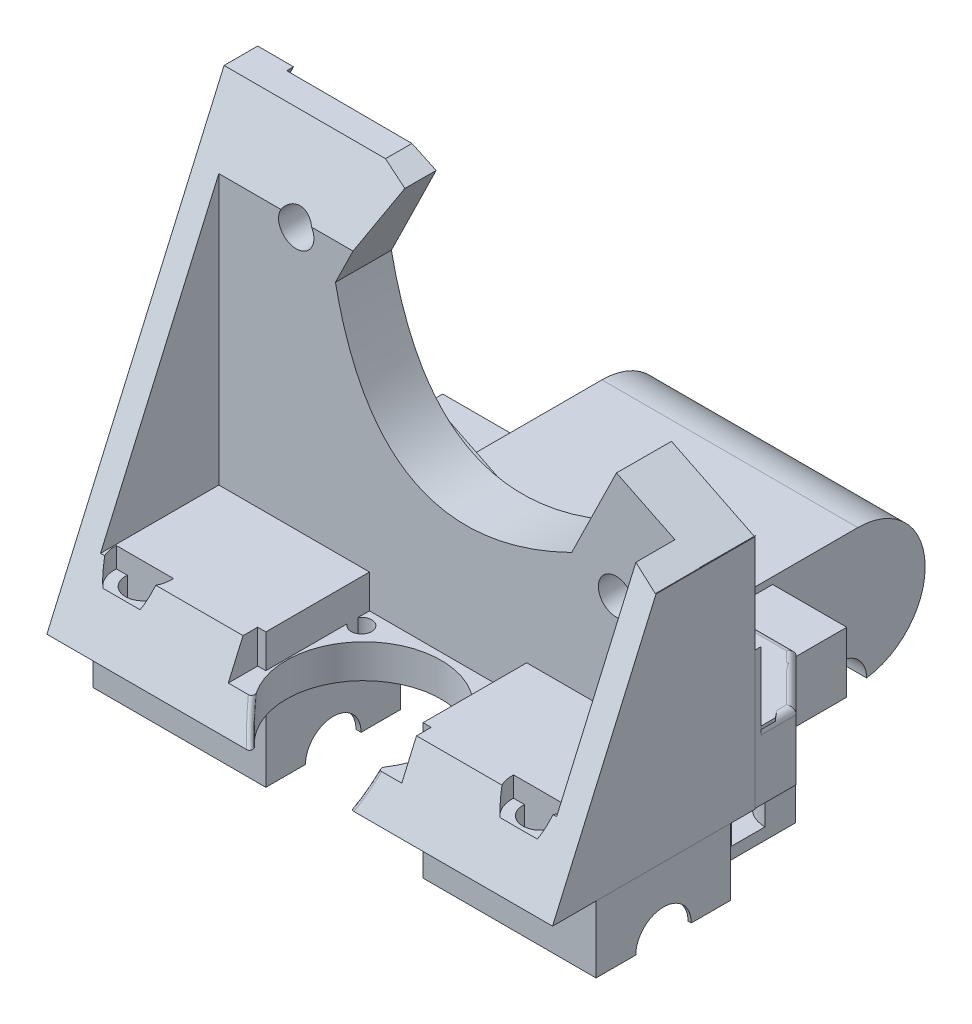
from build123d import *

# Parameters (mm, degrees)
BOSS_EXTRUDE1_DEPTH      = 10
SKETCH2_R                = 2.625
CUT_EXTRUDE1_DEPTH       = 60.256166666
SKETCH5_R                = 2.625
CUT_EXTRUDE2_DEPTH       = 60.256166666
BOSS_EXTRUDE2_DEPTH      = 50
CUT_EXTRUDE3_DEPTH       = 1
SKETCH9_R                = 2.625
SKETCH9_R_2              = 10
CUT_EXTRUDE4_DEPTH       = 91.614108358
CHAMFER1_SIZE            = 7.5
FILLET3_R                = 1
SKETCH15_R               = 4.25
CUT_EXTRUDE9_DEPTH       = 3
SKETCH16_W               = 7.5
SKETCH16_H               = 9
BOSS_EXTRUDE6_DEPTH      = 11
SKETCH17_W               = 7.5
SKETCH17_H               = 9
BOSS_EXTRUDE9_DEPTH      = 11
SKETCH21_W               = 6
SKETCH21_H               = 3
CUT_EXTRUDE11_DEPTH      = 7
SKETCH22_R               = 1.6
CUT_EXTRUDE12_DEPTH      = 10
CUT_EXTRUDE15_DEPTH      = 10
CUT_EXTRUDE16_DEPTH      = 10
SKETCH25_W               = 3.580558827
SKETCH25_H               = 21.958618269
BOSS_EXTRUDE10_DEPTH     = 50
BOSS_EXTRUDE11_REACH     = 78.885
SKETCH26_W               = 3.679136854
SKETCH26_H               = 21.958618269
CUT_EXTRUDE17_DEPTH      = 106.560517746
SKETCH29_W               = 25.765595736
SKETCH29_H               = 19.139339955
BOSS_EXTRUDE12_DEPTH     = 10
SKETCH31_R               = 1.525
SKETCH31_R_2             = 11.5
CUT_EXTRUDE19_DEPTH      = 77.884935493
CUT_EXTRUDE20_DEPTH      = 5
FILLET4_R                = 0.5
BOSS_EXTRUDE13_DEPTH     = 10
SKETCH34_W               = 24.1
SKETCH34_H               = 7.364955649
CUT_EXTRUDE22_DEPTH      = 90.295075006
CUT_EXTRUDE22_DEPTH_BACK = 90.295075006
SKETCH35_R               = 4.125
SKETCH36_W               = 5
SKETCH36_H               = 2
SKETCH37_W               = 25.69145529
SKETCH37_H               = 20
BOSS_EXTRUDE14_DEPTH     = 10
BOSS_EXTRUDE15_DEPTH     = 10
SKETCH39_W               = 24.446808458
SKETCH39_H               = 7.793957
SKETCH39_W_2             = 24.446808459
SKETCH40_W               = 5
SKETCH40_H               = 1.2
SKETCH48_W               = 51.725592451
SKETCH48_H               = 32.183815197
CUT_EXTRUDE25_DEPTH      = 20.1
CUT_EXTRUDE23_DEPTH      = 106.025353753
CUT_EXTRUDE23_DEPTH_BACK = 106.025353753
SKETCH41_R               = 4.125
SKETCH42_W               = 15
SKETCH42_H               = 10
BOSS_EXTRUDE16_DEPTH     = 10
SKETCH43_W               = 5
SKETCH43_H               = 6.5
SKETCH44_W               = 5
SKETCH44_H               = 6.5
SKETCH45_W               = 38.096015369
SKETCH45_H               = 15.40761422
CUT_EXTRUDE24_DEPTH      = 92.16629486
FILLET5_START            = -17.857142857
FILLET5_DEPTH            = 38
BOSS_EXTRUDE17_DEPTH     = 0.1


with BuildPart() as part:
    # Sketch1 → Boss-Extrude1 (new body)
    with BuildSketch(Plane(origin=(0, 0, 0), x_dir=(1, 0, 0), z_dir=(0, 1, 0))):
        Polygon((-36.357142857, 0), (-17.857142857, 0), (-17.857142857, 42.204761905), (20.142857143, 42.204761905), (20.142857143, 0), (38.642857143, 0), (38.642857143, -43.795238095), (-36.357142857, -43.795238095), align=None)
    extrude(amount=BOSS_EXTRUDE1_DEPTH)

    # Sketch2 → Cut-Extrude1 (cut, through all)
    with BuildSketch(Plane(origin=(0, 10, 0), x_dir=(1, 0, 0), z_dir=(0, 1, 0))):
        with Locations(Location((-9.357142857, 35.5, 0), (0, 0, 270))):
            Circle(SKETCH2_R)
        with Locations(Location((-9.357142857, 6.5, 0), (0, 0, 270))):
            Circle(SKETCH2_R)
        with Locations(Location((11.642857143, 6.790309892, 0), (0, 0, 270))):
            Circle(SKETCH2_R)
        with Locations(Location((11.642857143, 35.209690108, 0), (0, 0, 270))):
            Circle(SKETCH2_R)
    extrude(amount=-CUT_EXTRUDE1_DEPTH, mode=Mode.SUBTRACT)

    # Sketch5 → Cut-Extrude2 (cut, through all)
    with BuildSketch(Plane(origin=(0, 10, 0), x_dir=(1, 0, 0), z_dir=(0, 1, 0))):
        with Locations(Location((-28.357142857, -8.5, 0), (0, 0, 270))):
            Circle(SKETCH5_R)
        with Locations(Location((-7.357142857, -8.5, 0), (0, 0, 270))):
            Circle(SKETCH5_R)
        with Locations(Location((9.642857143, -8.5, 0), (0, 0, 270))):
            Circle(SKETCH5_R)
        with Locations(Location((30.642857143, -8.5, 0), (0, 0, 270))):
            Circle(SKETCH5_R)
        with Locations(Location((30.642857143, -37.5, 0), (0, 0, 90))):
            Circle(SKETCH5_R)
        with Locations(Location((9.642857143, -37.5, 0), (0, 0, 90))):
            Circle(SKETCH5_R)
        with Locations(Location((-7.357142857, -37.5, 0), (0, 0, 90))):
            Circle(SKETCH5_R)
        with Locations(Location((-28.357142857, -37.5, 0), (0, 0, 90))):
            Circle(SKETCH5_R)
    extrude(amount=-CUT_EXTRUDE2_DEPTH, mode=Mode.SUBTRACT)

    # Sketch7 → Boss-Extrude2 (add)
    with BuildSketch(Plane(origin=(0, 10, 0), x_dir=(1, 0, 0), z_dir=(0, 1, 0))):
        Polygon((-36.357142857, -12.477213959), (38.642857143, -12.729619316), (38.642857143, -21.836619826), (-36.357142857, -21.836619826), align=None)
    extrude(amount=BOSS_EXTRUDE2_DEPTH)

    # Sketch8 → Cut-Extrude3 (cut)
    with BuildSketch(Plane(origin=(-0.042402174, 0, 12.59942776), x_dir=(-0.9999943370734709, 0, -0.0033653857118391777), z_dir=(0.0033653857118391777, 0, -0.9999943370734709))):
        with BuildLine():
            Line((-31.912353979, 38.373204326), (27.387727058, 67.366180235))
            Line((27.387727058, 67.366180235), (35.513527358, 50.746271406))
            ThreePointArc((35.513527358, 50.746271406), (35.988094872, 43.107329762), (30.922117342, 37.370212417))
            Line((30.922117342, 37.370212417), (-22.980289671, 11.016265498))
            ThreePointArc((-22.980289671, 11.016265498), (-30.619231314, 10.541697984), (-36.356348659, 15.607675513))
            Line((-36.356348659, 15.607675513), (-44.482148959, 32.227584342))
            Line((-44.482148959, 32.227584342), (-31.912353979, 38.373204326))
        make_face()
    extrude(amount=-CUT_EXTRUDE3_DEPTH, mode=Mode.SUBTRACT)

    # Sketch9 → Cut-Extrude4 (cut, through all)
    with BuildSketch(Plane(origin=(-0.04576756, 0, 13.599422097), x_dir=(-0.9999943370734709, 0, -0.0033653857118391777), z_dir=(0.0033653857118391777, 0, -0.9999943370734709))):
        with Locations((-26.291016009, 25.155372155)):
            Circle(SKETCH9_R)
        with Locations((21.207792341, 48.760968945)):
            Circle(SKETCH9_R)
        with Locations((-3.792207659, 36.259696547)):
            Circle(SKETCH9_R_2)
    extrude(amount=-CUT_EXTRUDE4_DEPTH, mode=Mode.SUBTRACT)

    # Chamfer1
    chamfer1_edges = [part.edges().sort_by_distance(p)[0] for p in [
        (20.142857143, 5, -42.204761905),
        (-17.857142857, 5, -42.204761905),
        (38.642857143, 5, 0),
        (-36.357142857, 5, 0),
    ]]
    chamfer(chamfer1_edges, length=CHAMFER1_SIZE)

    # Fillet3
    fillet3_edges = [part.edges().sort_by_distance(p)[0] for p in [
        (38.642857143, 10, 10.114809658),
        (34.892857143, 10, 3.75),
        (25.642857143, 10, 0),
        (20.142857143, 10, -17.352380952),
        (16.392857143, 10, -38.454761905),
        (1.142857143, 10, -42.204761905),
        (-14.107142857, 10, -38.454761905),
        (-17.857142857, 10, -17.352380952),
        (-23.357142857, 10, 0),
        (-32.607142857, 10, 3.75),
        (-36.357142857, 10, 9.988606979),
    ]]
    fillet(fillet3_edges, radius=FILLET3_R)

    # Sketch15 → Cut-Extrude9 (cut)
    with BuildSketch(Plane(origin=(0, 10, 0), x_dir=(1, 0, 0), z_dir=(0, 1, 0))):
        with Locations(Location((-9.357142857, 35.5, 0), (0, 0, 270))):
            Circle(SKETCH15_R)
        with Locations(Location((11.642857143, 35.209690108, 0), (0, 0, 270))):
            Circle(SKETCH15_R)
        with Locations(Location((-9.357142857, 6.5, 0), (0, 0, 270))):
            Circle(SKETCH15_R)
        with Locations(Location((11.642857143, 6.790309892, 0), (0, 0, 270))):
            Circle(SKETCH15_R)
        with Locations(Location((-28.357142857, -8.5, 0), (0, 0, 270))):
            Circle(SKETCH15_R)
        with Locations(Location((-7.357142857, -8.5, 0), (0, 0, 270))):
            Circle(SKETCH15_R)
        with Locations(Location((9.642857143, -8.5, 0), (0, 0, 270))):
            Circle(SKETCH15_R)
        with Locations(Location((30.642857143, -8.5, 0), (0, 0, 270))):
            Circle(SKETCH15_R)
        with Locations(Location((-28.357142857, -37.5, 0), (0, 0, 270))):
            Circle(SKETCH15_R)
        with Locations(Location((-7.357142857, -37.5, 0), (0, 0, 270))):
            Circle(SKETCH15_R)
        with Locations(Location((9.642857143, -37.5, 0), (0, 0, 270))):
            Circle(SKETCH15_R)
        with Locations(Location((30.642857143, -37.5, 0), (0, 0, 270))):
            Circle(SKETCH15_R)
    extrude(amount=-CUT_EXTRUDE9_DEPTH, mode=Mode.SUBTRACT)

    # Sketch16 → Boss-Extrude6 (add)
    with BuildSketch(Plane(origin=(20.142857143, 0, 0), x_dir=(0, 0, -1), z_dir=(1, 0, 0))):
        with Locations((3.75, 4.5)):
            Rectangle(SKETCH16_W, SKETCH16_H)
    extrude(amount=BOSS_EXTRUDE6_DEPTH)

    # Sketch17 → Boss-Extrude9 (add)
    with BuildSketch(Plane.ZY.offset(17.857142857)):
        with Locations((-3.75, 4.5)):
            Rectangle(SKETCH17_W, SKETCH17_H)
    extrude(amount=BOSS_EXTRUDE9_DEPTH)

    # Sketch21 → Cut-Extrude11 (cut)
    with BuildSketch(Plane.XZ):
        with Locations((-22.857142857, -3)):
            Rectangle(SKETCH21_W, SKETCH21_H)
        with Locations((25.142857143, -3)):
            Rectangle(SKETCH21_W, SKETCH21_H)
    extrude(amount=-CUT_EXTRUDE11_DEPTH, mode=Mode.SUBTRACT)

    # Sketch22 → Cut-Extrude12 (cut)
    with BuildSketch(Plane(origin=(0, 0, -7.5), x_dir=(-1, 0, 0), z_dir=(0, 0, -1))):
        with Locations((-25.142857143, 3.5)):
            Circle(SKETCH22_R)
        with Locations((22.857142857, 3.5)):
            Circle(SKETCH22_R)
    extrude(amount=-CUT_EXTRUDE12_DEPTH, mode=Mode.SUBTRACT)

    # Sketch23 → Cut-Extrude15 (cut)
    with BuildSketch(Plane(origin=(-0.042402174, 0, 12.59942776), x_dir=(-0.9999943370734709, 0, -0.0033653857118391786), z_dir=(0.0033653857118391786, 0, -0.9999943370734709))):
        Polygon((-19.705841455, 27.529287927), (15.386124791, 44.73390951), (8.718401535, 58.333948214), (12.321488731, 60), (-2.141248789, 79.640429628), (-36.682044652, 62.706031657), (-39.926702886, 60.845402562), (-53.563436337, 52.440273331), (-38.68547839, 35.06169059), (-26.354542621, 41.090527608), align=None)
    extrude(amount=-CUT_EXTRUDE15_DEPTH, mode=Mode.SUBTRACT)

    # Sketch24 → Cut-Extrude16 (cut)
    with BuildSketch(Plane(origin=(-0.04576756, 0, 13.599422097), x_dir=(-0.9999943370734709, 0, -0.0033653857118391777), z_dir=(0.0033653857118391777, 0, -0.9999943370734709))):
        with BuildLine():
            Line((15.386124791, 44.73390951), (-19.705841455, 27.529287927))
            add(Edge.make_bspline(
                [(15.386124791, 44.73390951), (8.957921573, 13.454857167), (-19.705841455, 27.529287927)],
                knots=[0, 0, 0, 1, 1, 1], degree=2))
        make_face()
    extrude(amount=-CUT_EXTRUDE16_DEPTH, mode=Mode.SUBTRACT)

    # Sketch25 → Boss-Extrude10 (add)
    with BuildSketch(Plane(origin=(0, 10, 0), x_dir=(1, 0, 0), z_dir=(0, 1, 0))):
        with Locations((-34.566863443, -32.815928961)):
            Rectangle(SKETCH25_W, SKETCH25_H)
    extrude(amount=BOSS_EXTRUDE10_DEPTH)

    # Boss-Extrude11: up to this plane
    boss_extrude11_end = Plane(origin=(26.278337346, 41.090527608, 22.688064332), z_dir=(-0.43922996130995673, -0.8983734502154488, -0.001478186606866355))
    # Sketch26 → Boss-Extrude11 (add, up to the surface)
    with BuildSketch(Plane(origin=(0, 10, 0), x_dir=(1, 0, 0), z_dir=(0, 1, 0)), mode=Mode.PRIVATE) as boss_extrude11_sk1:
        with Locations((36.803288716, -32.815928961)):
            Rectangle(SKETCH26_W, SKETCH26_H)
    boss_extrude11_tool1 = split(extrude(boss_extrude11_sk1.sketch, amount=BOSS_EXTRUDE11_REACH, mode=Mode.PRIVATE), bisect_by=boss_extrude11_end, keep=Keep.BOTH, mode=Mode.PRIVATE)
    add(boss_extrude11_tool1.solids().sort_by_distance((36.803289, 10, 32.815929))[0])

    # Sketch28 → Cut-Extrude17 (cut, through all)
    with BuildSketch(Plane.ZY.offset(36.357142857)):
        Polygon((17.477213959, 60), (43.795238095, 0), (43.795238095, 60), align=None)
    extrude(amount=-CUT_EXTRUDE17_DEPTH, mode=Mode.SUBTRACT)

    # Sketch29 → Boss-Extrude12 (add)
    with BuildSketch(Plane(origin=(0, 10, 0), x_dir=(1, 0, 0), z_dir=(0, 1, 0))):
        with Locations((1.275655011, -31.406289804)):
            Rectangle(SKETCH29_W, SKETCH29_H)
    extrude(amount=-BOSS_EXTRUDE12_DEPTH)

    # Sketch31 → Cut-Extrude19 (cut, through all)
    with BuildSketch(Plane(origin=(0, 10, 0), x_dir=(1, 0, 0), z_dir=(0, 1, 0))):
        with Locations(Location((-9.107142857, -24.336619826, 0), (0, 0, 270))):
            Circle(SKETCH31_R)
        with Locations(Location((11.658452879, -24.336619826, 0), (0, 0, 270))):
            Circle(SKETCH31_R)
        with Locations((1.275655011, -34.364379744)):
            Circle(SKETCH31_R_2)
    extrude(amount=-CUT_EXTRUDE19_DEPTH, mode=Mode.SUBTRACT)

    # Sketch32 → Cut-Extrude20 (cut)
    with BuildSketch(Plane(origin=(0, 10, 0), x_dir=(1, 0, 0), z_dir=(0, 1, 0))):
        Polygon((-11.607142857, -43.187752085), (14.158452879, -43.08266469), (14.158452879, -21.836619826), (-11.607142857, -21.836619826), align=None)
    extrude(amount=-CUT_EXTRUDE20_DEPTH, mode=Mode.SUBTRACT)

    # Fillet4
    fillet4_edges = [part.edges().sort_by_distance(p)[0] for p in [
        (-6.62265692, 2.444476724, 42.723008138),
        (9.173966942, 2.444476724, 42.723008138),
    ]]
    fillet(fillet4_edges, radius=FILLET4_R)

    # Sketch33 → Boss-Extrude13 (add, symmetric)
    with BuildSketch(Plane.XZ):
        Polygon((-17.857142857, 0), (20.142857143, 0), (20.142857143, -34.704761905), (12.642857143, -42.204761905), (-10.357142857, -42.204761905), (-17.857142857, -34.704761905), align=None)
    extrude(amount=BOSS_EXTRUDE13_DEPTH, both=True)

    # Sketch34 → Cut-Revolve1 (revolve, cut)
    with BuildSketch(Plane.XZ.offset(10)):
        with Locations((1.138972231, -13.641022701)):
            Rectangle(SKETCH34_W, SKETCH34_H)
    revolve(axis=Axis((-10.911027769, -10, -17.323500525), (1, 0, 0)), mode=Mode.SUBTRACT)

    # Sketch35 → Cut-Extrude22 (cut, two sides: drawn at the far end of the back side and taken through both)
    with BuildSketch(Plane(origin=(-10.911027769, 0, 0), x_dir=(0, 0, -1), z_dir=(1, 0, 0)).offset(-CUT_EXTRUDE22_DEPTH_BACK)):
        with Locations((17.323500525, -10)):
            Circle(SKETCH35_R)
    extrude(amount=CUT_EXTRUDE22_DEPTH + CUT_EXTRUDE22_DEPTH_BACK, mode=Mode.SUBTRACT)

    # Sketch36 → Cut-Revolve2 (revolve, cut)
    with BuildSketch(Plane.XZ.offset(10)):
        with Locations((7.138972231, -27.091871259)):
            Rectangle(SKETCH36_W, SKETCH36_H)
        with Locations((-4.861027769, -27.091871259)):
            Rectangle(SKETCH36_W, SKETCH36_H)
        with Locations((7.138972231, -7.555129791)):
            Rectangle(SKETCH36_W, SKETCH36_H)
        with Locations((-4.861027769, -7.555129791)):
            Rectangle(SKETCH36_W, SKETCH36_H)
    revolve(axis=Axis((20.142857143, -10, -17.323500525), (-1, 0, 0)), mode=Mode.SUBTRACT)

    # Sketch37 → Boss-Extrude14 (add, symmetric)
    with BuildSketch(Plane.XZ):
        with Locations((-23.245819476, 27.230353711)):
            Rectangle(SKETCH37_W, SKETCH37_H)
        with Locations((25.797129498, 27.230353711)):
            Rectangle(SKETCH37_W, SKETCH37_H)
    extrude(amount=BOSS_EXTRUDE14_DEPTH, both=True)

    # Sketch38 → Boss-Extrude15 (add)
    with BuildSketch(Plane.XZ):
        Polygon((-35.091886553, 13.573372318), (38.487550204, 13.573372318), (38.487550204, 10.45903269), (32.435051505, 2.467189504), (-31.324332362, 2.467189504), (-35.091886553, 6.818822702), align=None)
    extrude(amount=-BOSS_EXTRUDE15_DEPTH)

    # Sketch39 → Cut-Revolve3 (revolve, cut)
    with BuildSketch(Plane.XZ.offset(10)):
        with Locations((-23.378617344, 31.10699488)):
            Rectangle(SKETCH39_W, SKETCH39_H)
        with Locations((25.929927367, 31.10699488)):
            Rectangle(SKETCH39_W_2, SKETCH39_H)
    revolve(axis=Axis((-35.602021573, -10, 27.21001638), (1, 0, 0)), mode=Mode.SUBTRACT)

    # Sketch40 → Cut-Revolve4 (revolve, cut)
    with BuildSketch(Plane.XZ.offset(10)):
        with Locations((-29.292043545, 36.112467077)):
            Rectangle(SKETCH40_W, SKETCH40_H)
        with Locations((-17.199595408, 36.112467077)):
            Rectangle(SKETCH40_W, SKETCH40_H)
        with Locations((19.873819344, 36.112467077)):
            Rectangle(SKETCH40_W, SKETCH40_H)
        with Locations((31.966267481, 36.112467077)):
            Rectangle(SKETCH40_W, SKETCH40_H)
    revolve(axis=Axis((-36.091547121, -10, 27.230353711), (1, 0, 0)), mode=Mode.SUBTRACT)

    # Sketch48 → Cut-Extrude25 (cut)
    with BuildSketch(Plane(origin=(-0.04576756, 0, 13.599422097), x_dir=(-0.9999943370734709, 0, -0.0033653857118391777), z_dir=(0.0033653857118391777, 0, -0.9999943370734709))):
        with Locations((-12.024050392, 52.29250725)):
            Rectangle(SKETCH48_W, SKETCH48_H)
    extrude(amount=CUT_EXTRUDE25_DEPTH, mode=Mode.SUBTRACT)

    # Sketch41 → Cut-Extrude23 (cut, two sides: drawn at the far end of the back side and taken through both)
    with BuildSketch(Plane(origin=(-35.602021573, 0, 0), x_dir=(0, 0, -1), z_dir=(1, 0, 0)).offset(-CUT_EXTRUDE23_DEPTH_BACK)):
        with Locations((-27.21001638, -10)):
            Circle(SKETCH41_R)
    extrude(amount=CUT_EXTRUDE23_DEPTH + CUT_EXTRUDE23_DEPTH_BACK, mode=Mode.SUBTRACT)

    # Sketch42 → Boss-Extrude16 (add)
    with BuildSketch(Plane.XZ):
        with Locations((-23.712334717, 7.5)):
            Rectangle(SKETCH42_W, SKETCH42_H)
        with Locations((25.998049003, 7.5)):
            Rectangle(SKETCH42_W, SKETCH42_H)
    extrude(amount=BOSS_EXTRUDE16_DEPTH)

    # Sketch43 → Cut-Revolve5 (revolve, cut)
    with BuildSketch(Plane(origin=(0, 0, 2.5), x_dir=(-1, 0, 0), z_dir=(0, 0, -1))):
        with Locations((24.212334717, -5)):
            Rectangle(SKETCH43_W, SKETCH43_H)
    revolve(axis=Axis((-31.212334717, -10, 2.5), (0, 1, 0)), mode=Mode.SUBTRACT)

    # Sketch44 → Cut-Revolve6 (revolve, cut)
    with BuildSketch(Plane(origin=(0, 0, 2.5), x_dir=(-1, 0, 0), z_dir=(0, 0, -1))):
        with Locations((-26.498049003, -5)):
            Rectangle(SKETCH44_W, SKETCH44_H)
    revolve(axis=Axis((33.498049003, -10, 2.5), (0, 1, 0)), mode=Mode.SUBTRACT)

    # Sketch45 → Cut-Extrude24 (cut, through all)
    with BuildSketch(Plane.XZ.offset(10)):
        with Locations((1.190864828, -37.848099653)):
            Rectangle(SKETCH45_W, SKETCH45_H)
    extrude(amount=-CUT_EXTRUDE24_DEPTH, mode=Mode.SUBTRACT)

    # Fillet5: read off the stored shape, not the designer's step
    # Fillet5 outline → Fillet5 (cut)
    with BuildSketch(Plane.YZ.offset(FILLET5_START)):
        with BuildLine():
            Line((10, -30.144292543), (10, -20.144292543))
            ThreePointArc((10, -20.144292543), (7.071067812, -27.215360355), (0, -30.144292543))
            Line((0, -30.144292543), (10, -30.144292543))
        make_face()
        with BuildLine():
            Line((-10, -30.144292543), (-0.085412689, -30.144292543))
            ThreePointArc((-0.085412689, -30.144292543), (-6.679270444, -27.662340156), (-10, -21.448500525))
            Line((-10, -21.448500525), (-10, -30.144292543))
        make_face()
    extrude(amount=FILLET5_DEPTH, mode=Mode.SUBTRACT)

    # Sketch46 → Boss-Extrude17 (add)
    with BuildSketch(Plane(origin=(38.642857143, 0, 0), x_dir=(0, 0, -1), z_dir=(1, 0, 0))):
        Polygon((-43.795238095, 0), (-28.427327272, 35.03586153), (-13.729624979, 35.060045178), (-13.729624979, 0), align=None)
    extrude(amount=BOSS_EXTRUDE17_DEPTH)


solid = part.part
